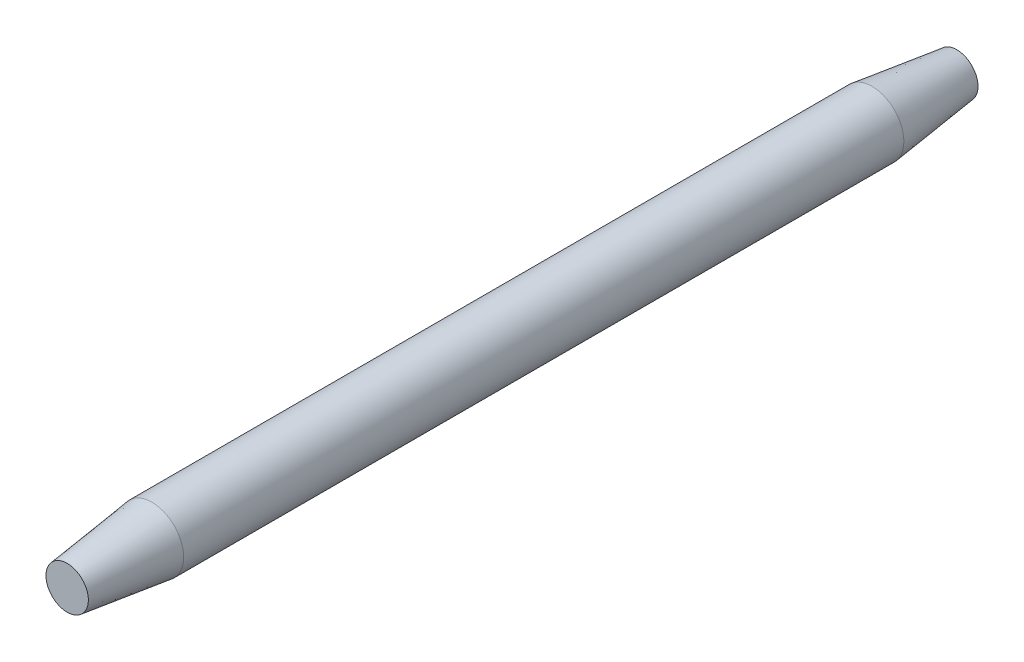
from build123d import *

# Parameters (mm, degrees)
SECTION_2_R         = 150
BOSS_EXTRUDE1_DEPTH = 3400


with BuildPart() as part:
    # Section 2 → Boss-Extrude1 (new body)
    with BuildSketch(Plane.XY):
        Circle(SECTION_2_R)
    extrude(amount=BOSS_EXTRUDE1_DEPTH)

    # ConoPopa → Revolve1 (revolve)
    with BuildSketch(Plane(origin=(0, 0, 0), x_dir=(0, 0, -1), z_dir=(1, 0, 0))):
        Polygon((400, 0), (400, 100), (0, 150), (0, 0), align=None)
    revolve(axis=Axis((0, 0, 0), (0, 0, -1)))

    # ConoProa → Revolve2 (revolve)
    with BuildSketch(Plane(origin=(0, 0, 0), x_dir=(0, 0, -1), z_dir=(1, 0, 0))):
        Polygon((-3800, 0), (-3800, 100), (-3400, 150), (-3400, 0), align=None)
    revolve(axis=Axis((0, 0, 3400), (0, 0, 1)))


solid = part.part
